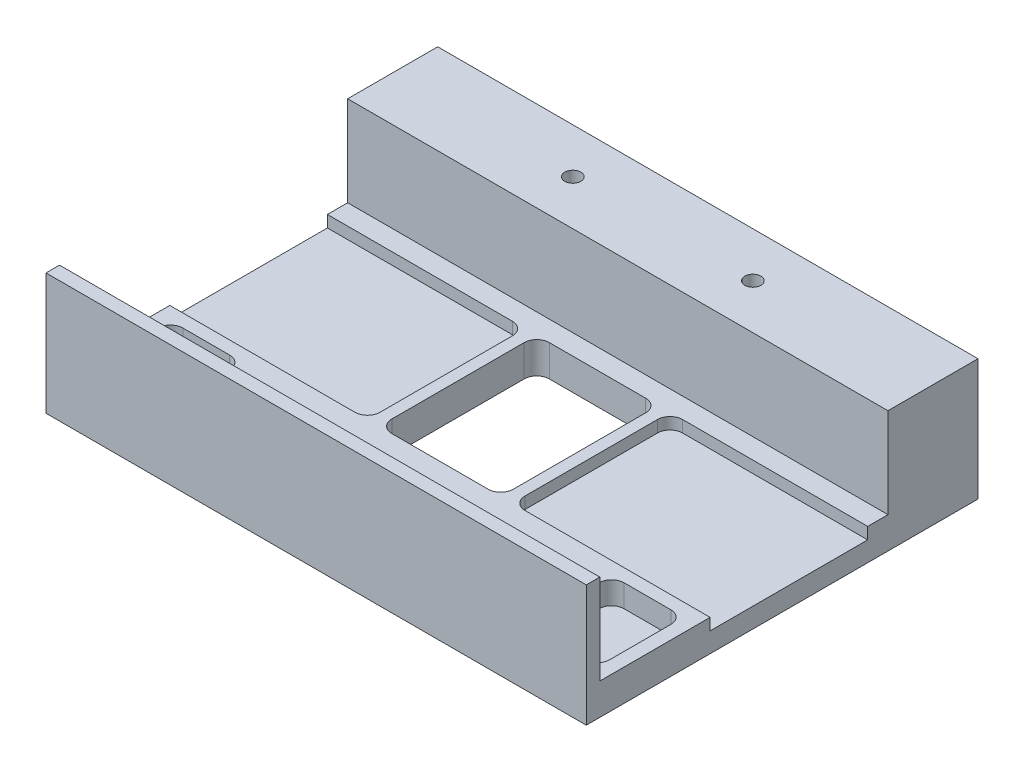
from build123d import *

# Parameters (mm, degrees)
SKETCH1_W                   = 76.2
SKETCH1_H                   = 44.45
BOSS_EXTRUDE1_DEPTH         = 4.445
SKETCH2_W                   = 76.2
SKETCH2_H                   = 1.905
BOSS_EXTRUDE2_DEPTH         = 12.7
CUT_EXTRUDE3_DEPTH          = 46.900442536
SKETCH7_W                   = 27.8765
SKETCH7_H                   = 22.225
CUT_EXTRUDE4_DEPTH          = 1.651
SKETCH11_W                  = 10.16
SKETCH11_H                  = 12.192
CUT_EXTRUDE6_DEPTH          = 3.175
SKETCH13_W                  = 76.2
SKETCH13_H                  = 17.145
BOSS_EXTRUDE3_DEPTH         = 12.7
FILLET1_R                   = 1.778
F_1_4_20_TAPPED_HOLE1_D     = 5.1054
F_1_4_20_TAPPED_HOLE1_DEPTH = 6.35
F_1_4_20_TAPPED_HOLE1_TIP   = 1.533816902
F_4_40_TAPPED_HOLE1_D       = 2.2606
F_4_40_TAPPED_HOLE1_DEPTH   = 6.35
F_4_40_TAPPED_HOLE1_TIP     = 0.679152758


with BuildPart() as part:
    # Sketch1 → Boss-Extrude1 (new body)
    with BuildSketch(Plane(origin=(0, 0, 0), x_dir=(1, 0, 0), z_dir=(0, 1, 0))):
        Rectangle(SKETCH1_W, SKETCH1_H)
    extrude(amount=BOSS_EXTRUDE1_DEPTH)

    # Sketch2 → Boss-Extrude2 (add)
    with BuildSketch(Plane(origin=(0, 4.445, 0), x_dir=(1, 0, 0), z_dir=(0, 1, 0))):
        with Locations((0, 21.2725)):
            Rectangle(SKETCH2_W, SKETCH2_H)
        with Locations((0, -21.2725)):
            Rectangle(SKETCH2_W, SKETCH2_H)
    extrude(amount=BOSS_EXTRUDE2_DEPTH)

    # Sketch6 → Cut-Extrude3 (cut, through all)
    with BuildSketch(Plane(origin=(0, 4.445, 0), x_dir=(1, 0, 0), z_dir=(0, 1, 0))):
        with BuildLine():
            Line((-8.5725, 15.6845), (-8.5725, -2.9845))
            ThreePointArc((-8.5725, -2.9845), (-8.051735857, -4.241735857), (-6.7945, -4.7625))
            Line((-6.7945, -4.7625), (6.7945, -4.7625))
            ThreePointArc((6.7945, -4.7625), (8.051735857, -4.241735857), (8.5725, -2.9845))
            Line((8.5725, -2.9845), (8.5725, 15.6845))
            ThreePointArc((8.5725, 15.6845), (8.051735857, 16.941735857), (6.7945, 17.4625))
            Line((6.7945, 17.4625), (-6.7945, 17.4625))
            ThreePointArc((-6.7945, 17.4625), (-8.051735857, 16.941735857), (-8.5725, 15.6845))
        make_face()
    extrude(amount=-CUT_EXTRUDE3_DEPTH, mode=Mode.SUBTRACT)

    # Sketch7 → Cut-Extrude4 (cut)
    with BuildSketch(Plane(origin=(0, 4.445, 0), x_dir=(1, 0, 0), z_dir=(0, 1, 0))):
        with Locations((-24.16175, 6.35)):
            Rectangle(SKETCH7_W, SKETCH7_H)
        with Locations((24.16175, 6.35)):
            Rectangle(SKETCH7_W, SKETCH7_H)
    extrude(amount=-CUT_EXTRUDE4_DEPTH, mode=Mode.SUBTRACT)

    # Sketch11 → Cut-Extrude6 (cut)
    with BuildSketch(Plane(origin=(0, 4.445, 0), x_dir=(1, 0, 0), z_dir=(0, 1, 0))):
        with Locations((-31.115, -12.7)):
            Rectangle(SKETCH11_W, SKETCH11_H)
        with Locations((31.115, -12.7)):
            Rectangle(SKETCH11_W, SKETCH11_H)
    extrude(amount=-CUT_EXTRUDE6_DEPTH, mode=Mode.SUBTRACT)

    # Sketch13 → Boss-Extrude3 (add)
    with BuildSketch(Plane.XY.offset(-20.32)):
        with Locations((0, 8.5725)):
            Rectangle(SKETCH13_W, SKETCH13_H)
    extrude(amount=-BOSS_EXTRUDE3_DEPTH)

    # Fillet1
    fillet1_edges = [part.edges().sort_by_distance(p)[0] for p in [
        (-36.195, 2.8575, 6.604),
        (-26.035, 2.8575, 6.604),
        (26.035, 2.8575, 18.796),
        (36.195, 2.8575, 18.796),
        (26.035, 2.8575, 6.604),
        (36.195, 2.8575, 6.604),
        (-36.195, 2.8575, 18.796),
        (-26.035, 2.8575, 18.796),
        (-10.2235, 3.6195, 4.7625),
        (-10.2235, 3.6195, -17.4625),
        (10.2235, 3.6195, -17.4625),
        (10.2235, 3.6195, 4.7625),
    ]]
    fillet(fillet1_edges, radius=FILLET1_R)

    # 1/4-20 Tapped Hole1
    with Locations(Plane(origin=(0, 0, -33.02), x_dir=(-1, 0, 0), z_dir=(0, 0, -1))):
        with Locations((-25.452102946, 8.5725), (25.452102946, 8.5725)):
            Hole(F_1_4_20_TAPPED_HOLE1_D / 2, depth=F_1_4_20_TAPPED_HOLE1_DEPTH)
            with Locations((0, 0, -(F_1_4_20_TAPPED_HOLE1_DEPTH + F_1_4_20_TAPPED_HOLE1_TIP / 2))):  # 118° drill point
                Cone(0, F_1_4_20_TAPPED_HOLE1_D / 2, F_1_4_20_TAPPED_HOLE1_TIP, mode=Mode.SUBTRACT)

    # #4-40 Tapped Hole1
    with Locations(Plane(origin=(0, 17.145, 0), x_dir=(-1, 0, 0), z_dir=(0, 1, 0))):
        with Locations((12.7, -26.67), (-12.7, -26.67)):
            Hole(F_4_40_TAPPED_HOLE1_D / 2, depth=F_4_40_TAPPED_HOLE1_DEPTH)
            with Locations((0, 0, -(F_4_40_TAPPED_HOLE1_DEPTH + F_4_40_TAPPED_HOLE1_TIP / 2))):  # 118° drill point
                Cone(0, F_4_40_TAPPED_HOLE1_D / 2, F_4_40_TAPPED_HOLE1_TIP, mode=Mode.SUBTRACT)


solid = part.part
